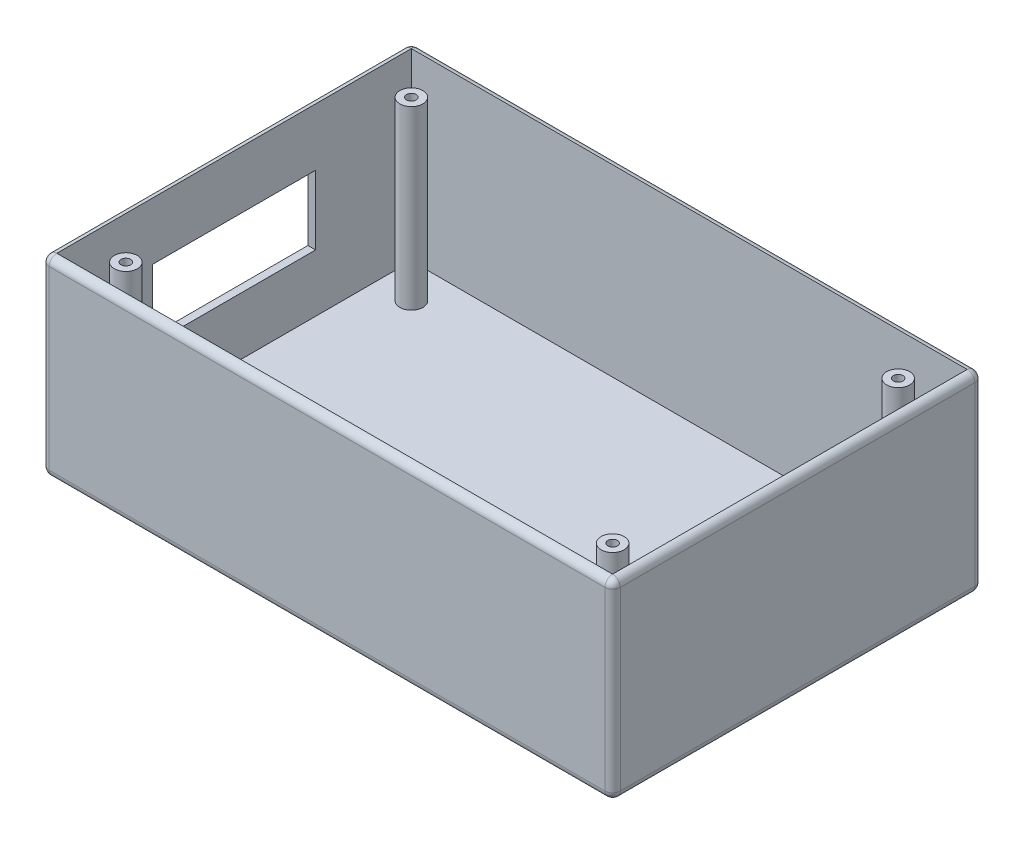
from build123d import *

# Parameters (mm, degrees)
SKETCH1_W           = 149
SKETCH1_H           = 96.5
BOSS_EXTRUDE1_DEPTH = 50
SHELL2_T            = -2
SKETCH2_R           = 3
BOSS_EXTRUDE2_DEPTH = 46
SKETCH3_W           = 42.5
SKETCH3_H           = 18
CUT_EXTRUDE1_DEPTH  = 46
SKETCH4_R           = 1.25
CUT_EXTRUDE2_DEPTH  = 46
FILLET1_R           = 2


with BuildPart() as part:
    # Sketch1 → Boss-Extrude1 (new body)
    with BuildSketch(Plane(origin=(0, 0, 0), x_dir=(1, 0, 0), z_dir=(0, 1, 0))):
        Rectangle(SKETCH1_W, SKETCH1_H)
    extrude(amount=BOSS_EXTRUDE1_DEPTH)

    # Shell2
    shell2_openings = [part.faces().sort_by_distance(p)[0] for p in [
        (0, 50, 0),
    ]]
    offset(amount=SHELL2_T, openings=shell2_openings, kind=Kind.INTERSECTION)

    # Sketch2 → Boss-Extrude2 (add)
    with BuildSketch(Plane(origin=(0, 2, 0), x_dir=(1, 0, 0), z_dir=(0, 1, 0))):
        with Locations(Location((-63.5, 37.25, 0), (0, 0, 270))):
            Circle(SKETCH2_R)
        with Locations(Location((63.5, 37.25, 0), (0, 0, 270))):
            Circle(SKETCH2_R)
        with Locations(Location((63.5, -37.25, 0), (0, 0, 270))):
            Circle(SKETCH2_R)
        with Locations(Location((-63.5, -37.25, 0), (0, 0, 270))):
            Circle(SKETCH2_R)
    extrude(amount=BOSS_EXTRUDE2_DEPTH)

    # Sketch3 → Cut-Extrude1 (cut)
    with BuildSketch(Plane(origin=(-72.5, 0, 0), x_dir=(0, 0, -1), z_dir=(1, 0, 0))):
        with Locations((0, 26)):
            Rectangle(SKETCH3_W, SKETCH3_H)
    extrude(amount=-CUT_EXTRUDE1_DEPTH, mode=Mode.SUBTRACT)

    # Sketch4 → Cut-Extrude2 (cut)
    with BuildSketch(Plane(origin=(0, 48, 0), x_dir=(1, 0, 0), z_dir=(0, 1, 0))):
        with Locations(Location((63.5, -37.25, 0), (0, 0, 270))):
            Circle(SKETCH4_R)
        with Locations(Location((-63.5, 37.25, 0), (0, 0, 270))):
            Circle(SKETCH4_R)
        with Locations(Location((-63.5, -37.25, 0), (0, 0, 270))):
            Circle(SKETCH4_R)
        with Locations(Location((63.5, 37.25, 0), (0, 0, 270))):
            Circle(SKETCH4_R)
    extrude(amount=-CUT_EXTRUDE2_DEPTH, mode=Mode.SUBTRACT)

    # Fillet1
    fillet1_edges = [part.edges().sort_by_distance(p)[0] for p in [
        (-74.5, 50, 0),
        (0, 50, 48.25),
        (74.5, 50, 0),
        (0, 0, 48.25),
        (-74.5, 0, 0),
        (0, 0, -48.25),
        (74.5, 0, 0),
        (74.5, 25, 48.25),
        (-74.5, 25, 48.25),
        (-74.5, 25, -48.25),
        (74.5, 25, -48.25),
        (0, 50, -48.25),
    ]]
    fillet(fillet1_edges, radius=FILLET1_R - 0.0001)  # a hair under: the kernel refuses the full size


solid = part.part
